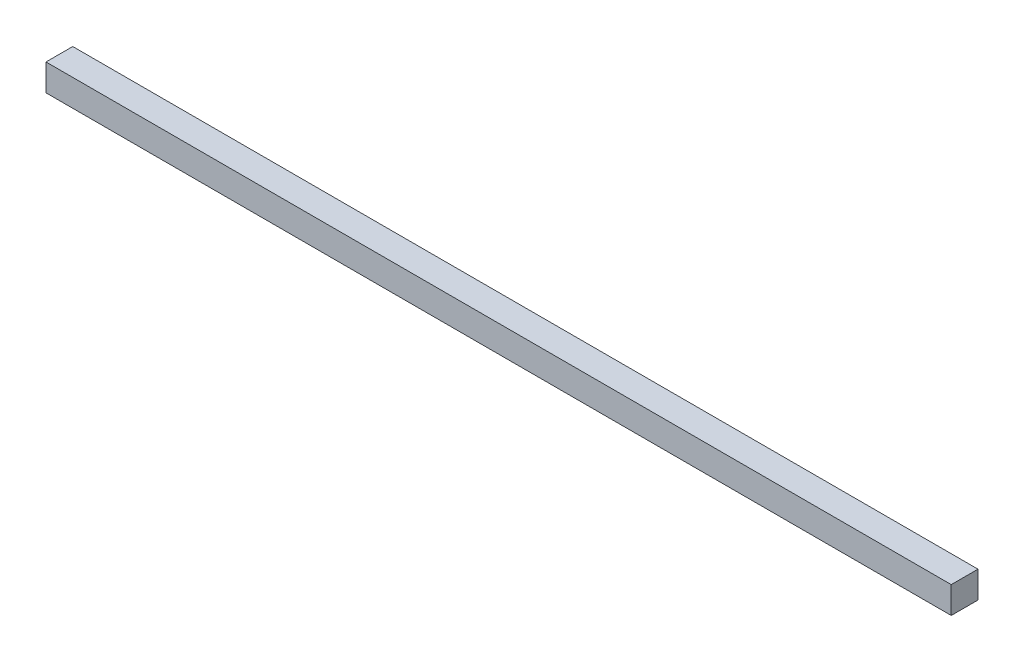
from build123d import *

# Parameters (mm, degrees)
SKETCH_1_W      = 9
SKETCH_1_H      = 9
EXTRUDE_1_DEPTH = 304.5


with BuildPart() as part:
    # Эскиз1 → Бобышка-Вытянуть1 (new body)
    with BuildSketch(Plane(origin=(0, 0, 0), x_dir=(0, 0, -1), z_dir=(1, 0, 0))):
        with Locations((4.5, 4.5)):
            Rectangle(SKETCH_1_W, SKETCH_1_H)
    extrude(amount=EXTRUDE_1_DEPTH)


solid = part.part
